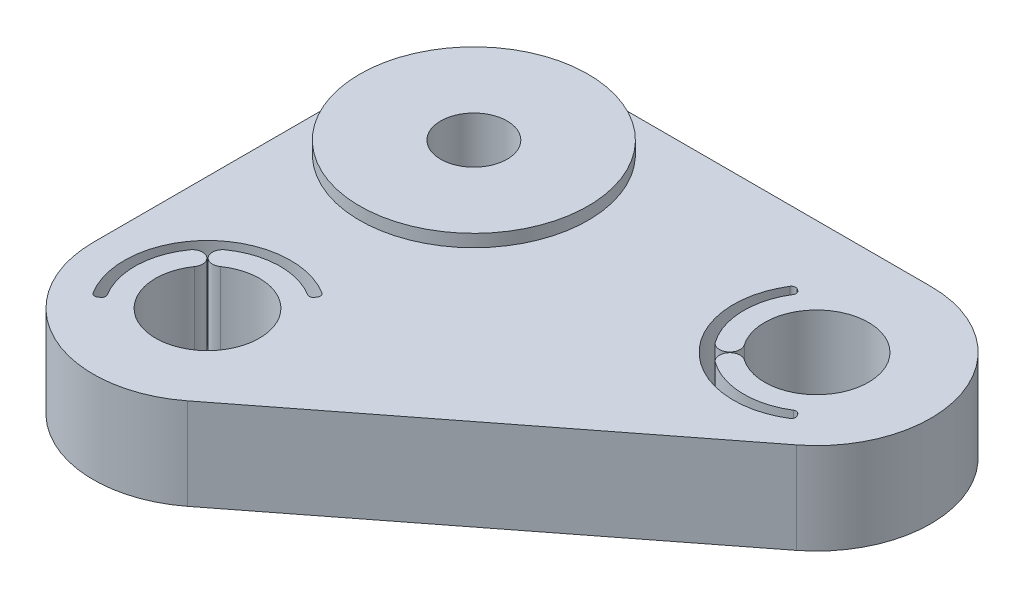
from build123d import *

# Parameters (mm, degrees)
SKETCH2_R            = 1.6
SKETCH2_R_2          = 2.5
BOSS_EXTRUDE1_DEPTH  = 1.57
SKETCH3_R            = 2.5
SKETCH3_R_2          = 1.6
BOSS_EXTRUDE2_DEPTH  = 2.83
SKETCH4_R            = 5.5
SKETCH4_R_2          = 1.6
BOSS_EXTRUDE3_DEPTH  = 0.6
BORE_RELIEF_DEPTH    = 30.065540164
SKETCH6_W            = 1.221153846
SKETCH6_H            = 0.325641026
PART_NUM_RIGHT_DEPTH = 0.4


with BuildPart() as part:
    # Sketch2 → Boss-Extrude1 (new body)
    with BuildSketch(Plane(origin=(0, 0, 0), x_dir=(1, 0, 0), z_dir=(0, 1, 0))):
        with BuildLine():
            Line((-5.5, 0), (-5.5, 12.825))
            ThreePointArc((-5.5, 12.825), (-3.889087297, 16.714087297), (0, 18.325))
            Line((0, 18.325), (16.5, 18.325))
            ThreePointArc((16.5, 18.325), (21.702583448, 14.609131572), (19.875306686, 8.48250017))
            Line((19.875306686, 8.48250017), (3.375306686, -4.34249983))
            ThreePointArc((3.375306686, -4.34249983), (-2.417210502, -4.940353569), (-5.5, 0))
        make_face()
        with Locations((0, 12.825)):
            Circle(SKETCH2_R, mode=Mode.SUBTRACT)
        with Locations((16.5, 12.825)):
            Circle(SKETCH2_R_2, mode=Mode.SUBTRACT)
        Circle(SKETCH2_R_2, mode=Mode.SUBTRACT)
    extrude(amount=BOSS_EXTRUDE1_DEPTH)

    # Sketch3 → Boss-Extrude2 (add)
    with BuildSketch(Plane(origin=(0, 1.57, 0), x_dir=(1, 0, 0), z_dir=(0, 1, 0))):
        with BuildLine():
            Line((3.375306686, -4.34249983), (19.875306686, 8.48250017))
            ThreePointArc((19.875306686, 8.48250017), (21.702583448, 14.609131572), (16.5, 18.325))
            Line((16.5, 18.325), (0, 18.325))
            ThreePointArc((0, 18.325), (-3.889087297, 16.714087297), (-5.5, 12.825))
            Line((-5.5, 12.825), (-5.5, 0))
            ThreePointArc((-5.5, 0), (-2.417210502, -4.940353569), (3.375306686, -4.34249983))
        make_face()
        Circle(SKETCH3_R, mode=Mode.SUBTRACT)
        with Locations((16.5, 12.825)):
            Circle(SKETCH3_R, mode=Mode.SUBTRACT)
        with Locations((0, 12.825)):
            Circle(SKETCH3_R_2, mode=Mode.SUBTRACT)
    extrude(amount=BOSS_EXTRUDE2_DEPTH)

    # Sketch4 → Boss-Extrude3 (add)
    with BuildSketch(Plane(origin=(0, 4.4, 0), x_dir=(1, 0, 0), z_dir=(0, 1, 0))):
        with Locations((0, 12.825)):
            Circle(SKETCH4_R)
        with Locations((0, 12.825)):
            Circle(SKETCH4_R_2, mode=Mode.SUBTRACT)
    extrude(amount=BOSS_EXTRUDE3_DEPTH)

    # Sketch5 → bore relief (cut, through all)
    with BuildSketch(Plane.XZ):
        with BuildLine():
            Line((13.473568524, -14.944130133), (13.391536548, -15.001569541))
            ThreePointArc((13.391536548, -15.001569541), (13.236918666, -15.033718169), (13.107180275, -14.943672771))
            ThreePointArc((13.107180275, -14.943672771), (13.671572875, -9.996572875), (18.618672771, -9.432180275))
            ThreePointArc((18.618672771, -9.432180275), (18.708718169, -9.561918666), (18.676569541, -9.716536548))
            Line((18.676569541, -9.716536548), (18.619130133, -9.798568524))
            ThreePointArc((18.619130133, -9.798568524), (18.495341896, -9.879803803), (18.349607847, -9.853644954))
            ThreePointArc((18.349607847, -9.853644954), (16.405370812, -9.326279474), (14.492482473, -9.957967845))
            ThreePointArc((14.492482473, -9.957967845), (14.369694669, -10.654332085), (15.066058909, -10.777119889))
            ThreePointArc((15.066058909, -10.777119889), (14.732233047, -11.057233047), (14.452119889, -11.391058909))
            ThreePointArc((14.452119889, -11.391058909), (14.329332085, -10.694694669), (13.632967845, -10.817482473))
            ThreePointArc((13.632967845, -10.817482473), (13.001279474, -12.730370812), (13.528644954, -14.674607847))
            ThreePointArc((13.528644954, -14.674607847), (13.554803803, -14.820341896), (13.473568524, -14.944130133))
        make_face()
        with BuildLine():
            Line((2.119130133, -3.026431476), (2.176569541, -3.108463452))
            ThreePointArc((2.176569541, -3.108463452), (2.208718169, -3.263081334), (2.118672771, -3.392819725))
            ThreePointArc((2.118672771, -3.392819725), (-2.828427125, -2.828427125), (-3.392819725, 2.118672771))
            ThreePointArc((-3.392819725, 2.118672771), (-3.263081334, 2.208718169), (-3.108463452, 2.176569541))
            Line((-3.108463452, 2.176569541), (-3.026431476, 2.119130133))
            ThreePointArc((-3.026431476, 2.119130133), (-2.945196197, 1.995341896), (-2.971355046, 1.849607847))
            ThreePointArc((-2.971355046, 1.849607847), (-3.498720526, -0.094629188), (-2.867032155, -2.007517527))
            ThreePointArc((-2.867032155, -2.007517527), (-2.170667915, -2.130305331), (-2.047880111, -1.433941091))
            ThreePointArc((-2.047880111, -1.433941091), (-1.767766953, -1.767766953), (-1.433941091, -2.047880111))
            ThreePointArc((-1.433941091, -2.047880111), (-2.130305331, -2.170667915), (-2.007517527, -2.867032155))
            ThreePointArc((-2.007517527, -2.867032155), (-0.094629188, -3.498720526), (1.849607847, -2.971355046))
            ThreePointArc((1.849607847, -2.971355046), (1.995341896, -2.945196197), (2.119130133, -3.026431476))
        make_face()
    extrude(amount=-BORE_RELIEF_DEPTH, mode=Mode.SUBTRACT)

    # Sketch6 → Part Num Right (cut)
    # profile 1 of 6: a face of its own
    with BuildSketch(Plane(origin=(0, 0, -18.325), x_dir=(-1, 0, 0), z_dir=(0, 0, -1))):
        with BuildLine():
            Line((-1.45224359, 0.625), (-2.0876252, 0.625))
            add(Edge.make_bspline(
                [(-2.0876252, 0.625), (-2.130026081, 0.625141139), (-2.211440469, 0.625412141), (-2.328074793, 0.626923226), (-2.43405366, 0.631254248), (-2.529321657, 0.63498132), (-2.613877037, 0.641777582), (-2.687979079, 0.648273311), (-2.75128649, 0.656776561), (-2.789609513, 0.664673623), (-2.806961138, 0.668249199)],
                knots=[0, 0, 0, 0, 1.410062039, 2.707475311, 3.878576406, 4.937260626, 5.877586885, 6.699081471, 7.410979367, 8, 8, 8, 8], degree=3))
            add(Edge.make_bspline(
                [(-2.806961138, 0.668249199), (-2.830190395, 0.673987843), (-2.876153367, 0.685342711), (-2.942323824, 0.709354569), (-3.00540418, 0.737096928), (-3.065163434, 0.769930236), (-3.121585925, 0.807300062), (-3.174665971, 0.849356633), (-3.22369187, 0.896460289), (-3.27040789, 0.946659811), (-3.311199899, 1.002140823), (-3.347923528, 1.060087813), (-3.378751756, 1.121616403), (-3.403010132, 1.186416258), (-3.423346638, 1.253851724), (-3.437014669, 1.324589154), (-3.445527358, 1.398398406), (-3.446368412, 1.448619001), (-3.446794872, 1.474083534)],
                knots=[0, 0, 0, 0, 1.027276577, 2.032638556, 3.019345632, 3.985365262, 4.957888996, 5.923693931, 6.890056973, 7.876427719, 8.865527834, 9.843495157, 10.821038291, 11.815616373, 12.812734995, 13.843357168, 14.906466538, 16, 16, 16, 16], degree=3))
            add(Edge.make_bspline(
                [(-3.446794872, 1.474083534), (-3.445462315, 1.516388284), (-3.442862152, 1.59893581), (-3.418618182, 1.718733216), (-3.378908392, 1.830486009), (-3.324180043, 1.934038669), (-3.25451789, 2.027427231), (-3.170799824, 2.109176017), (-3.073453386, 2.178216591), (-2.982404769, 2.22558451), (-2.901939035, 2.256063059), (-2.835500191, 2.277615533), (-2.762971613, 2.293986719), (-2.685393831, 2.30886584), (-2.602167628, 2.320219804), (-2.513460601, 2.328283277), (-2.419050889, 2.333468151), (-2.354335533, 2.334225683), (-2.32104367, 2.334615385)],
                knots=[0, 0, 0, 0, 1.260402266, 2.459371274, 3.627181936, 4.786749125, 5.93865593, 7.087644312, 8.261344208, 9.485713728, 10.136162886, 10.825977872, 11.566646758, 12.35154167, 13.181268117, 14.0701832, 15.007234106, 16, 16, 16, 16], degree=3))
            Line((-2.32104367, 2.334615385), (-3.4875, 3.8))
            Line((-3.4875, 3.8), (-3.135146234, 3.8))
            Line((-3.135146234, 3.8), (-1.968689904, 2.334615385))
            Line((-1.968689904, 2.334615385), (-1.737179487, 2.334615385))
            Line((-1.737179487, 2.334615385), (-1.737179487, 3.8))
            Line((-1.737179487, 3.8), (-1.45224359, 3.8))
            Line((-1.45224359, 3.8), (-1.45224359, 0.625))
        make_face()
        with BuildLine():
            Line((-1.737179487, 0.950641026), (-1.737179487, 2.008974359))
            Line((-1.737179487, 2.008974359), (-2.318499599, 2.013426482))
            add(Edge.make_bspline(
                [(-2.318499599, 2.013426482), (-2.345641352, 2.013438497), (-2.3982498, 2.013461784), (-2.474359643, 2.009838765), (-2.545225902, 2.005717644), (-2.610576629, 1.999412535), (-2.670443958, 1.991291581), (-2.724788345, 1.981117517), (-2.773729885, 1.96931444), (-2.830628281, 1.950859418), (-2.894895113, 1.922881499), (-2.963298511, 1.879499305), (-3.023115323, 1.827034935), (-3.072846399, 1.76628401), (-3.112790455, 1.699202433), (-3.14053516, 1.627308361), (-3.158818759, 1.551734554), (-3.160833885, 1.499844063), (-3.161858974, 1.473447516)],
                knots=[0, 0, 0, 0, 1.146399208, 2.222048177, 3.218135709, 4.144938032, 4.994811973, 5.769438708, 6.479732432, 7.119818093, 8.294689872, 9.430121864, 10.527913442, 11.641375077, 12.733452768, 13.811150417, 14.886538365, 16, 16, 16, 16], degree=3))
            add(Edge.make_bspline(
                [(-3.161858974, 1.473447516), (-3.160781981, 1.447909559), (-3.158647773, 1.397302648), (-3.140826274, 1.323382177), (-3.111726588, 1.253093511), (-3.071896587, 1.187403868), (-3.022323878, 1.128216571), (-2.964582838, 1.077729723), (-2.90003224, 1.035786689), (-2.840189636, 1.008112572), (-2.786310218, 0.991829079), (-2.739745176, 0.98000891), (-2.686671932, 0.971730598), (-2.627715149, 0.964116763), (-2.562615835, 0.957669012), (-2.491334318, 0.953389312), (-2.413921566, 0.950831329), (-2.360266864, 0.950705936), (-2.332491987, 0.950641026)],
                knots=[0, 0, 0, 0, 1.100596872, 2.180981401, 3.259506136, 4.371595435, 5.481727359, 6.576991111, 7.667816242, 8.793363246, 9.406619729, 10.09427138, 10.864108636, 11.721733836, 12.6590937, 13.685439239, 14.801845161, 16, 16, 16, 16], degree=3))
            Line((-2.332491987, 0.950641026), (-1.737179487, 0.950641026))
        make_face(mode=Mode.SUBTRACT)
    # profile 2 of 6: a face of its own
    with BuildSketch(Plane(origin=(0, 0, -18.325), x_dir=(-1, 0, 0), z_dir=(0, 0, -1))):
        Polygon((-3.914903846, 0.625), (-4.24372496, 0.625), (-5.075, 1.923747997), (-5.90627504, 0.625), (-6.235096154, 0.625), (-5.239728566, 2.180699119), (-6.275801282, 3.8), (-5.946980168, 3.8), (-5.075, 2.43765024), (-4.203019832, 3.8), (-3.874198718, 3.8), (-4.910907452, 2.180699119), align=None)
    # profile 3 of 6: a face of its own
    with BuildSketch(Plane(origin=(0, 0, -18.325), x_dir=(-1, 0, 0), z_dir=(0, 0, -1))):
        with BuildLine():
            Line((-6.825320513, 0.625), (-7.460702123, 0.625))
            add(Edge.make_bspline(
                [(-7.460702123, 0.625), (-7.503103004, 0.625141139), (-7.584517392, 0.625412141), (-7.701151716, 0.626923226), (-7.807130583, 0.631254248), (-7.90239858, 0.63498132), (-7.98695396, 0.641777582), (-8.061056002, 0.648273311), (-8.124363413, 0.656776561), (-8.162686436, 0.664673623), (-8.180038061, 0.668249199)],
                knots=[0, 0, 0, 0, 1.410062039, 2.707475311, 3.878576406, 4.937260626, 5.877586885, 6.699081471, 7.410979367, 8, 8, 8, 8], degree=3))
            add(Edge.make_bspline(
                [(-8.180038061, 0.668249199), (-8.203267318, 0.673987843), (-8.24923029, 0.685342711), (-8.315400747, 0.709354569), (-8.378481103, 0.737096928), (-8.438240357, 0.769930236), (-8.494662849, 0.807300062), (-8.547742894, 0.849356633), (-8.596768793, 0.896460289), (-8.643484813, 0.946659811), (-8.684276822, 1.002140823), (-8.721000451, 1.060087813), (-8.75182868, 1.121616403), (-8.776087055, 1.186416258), (-8.796423562, 1.253851724), (-8.810091593, 1.324589154), (-8.818604281, 1.398398406), (-8.819445335, 1.448619001), (-8.819871795, 1.474083534)],
                knots=[0, 0, 0, 0, 1.027276577, 2.032638556, 3.019345632, 3.985365262, 4.957888996, 5.923693931, 6.890056973, 7.876427719, 8.865527834, 9.843495157, 10.821038291, 11.815616373, 12.812734995, 13.843357168, 14.906466538, 16, 16, 16, 16], degree=3))
            add(Edge.make_bspline(
                [(-8.819871795, 1.474083534), (-8.818539238, 1.516388284), (-8.815939075, 1.59893581), (-8.791695105, 1.718733216), (-8.751985315, 1.830486009), (-8.697256966, 1.934038669), (-8.627594813, 2.027427231), (-8.543876747, 2.109176017), (-8.446530309, 2.178216591), (-8.355481692, 2.22558451), (-8.275015958, 2.256063059), (-8.208577114, 2.277615533), (-8.136048536, 2.293986719), (-8.058470754, 2.30886584), (-7.975244551, 2.320219804), (-7.886537524, 2.328283277), (-7.792127812, 2.333468151), (-7.727412456, 2.334225683), (-7.694120593, 2.334615385)],
                knots=[0, 0, 0, 0, 1.260402266, 2.459371274, 3.627181936, 4.786749125, 5.93865593, 7.087644312, 8.261344208, 9.485713728, 10.136162886, 10.825977872, 11.566646758, 12.35154167, 13.181268117, 14.0701832, 15.007234106, 16, 16, 16, 16], degree=3))
            Line((-7.694120593, 2.334615385), (-8.860576923, 3.8))
            Line((-8.860576923, 3.8), (-8.508223157, 3.8))
            Line((-8.508223157, 3.8), (-7.341766827, 2.334615385))
            Line((-7.341766827, 2.334615385), (-7.11025641, 2.334615385))
            Line((-7.11025641, 2.334615385), (-7.11025641, 3.8))
            Line((-7.11025641, 3.8), (-6.825320513, 3.8))
            Line((-6.825320513, 3.8), (-6.825320513, 0.625))
        make_face()
        with BuildLine():
            Line((-7.11025641, 0.950641026), (-7.11025641, 2.008974359))
            Line((-7.11025641, 2.008974359), (-7.691576522, 2.013426482))
            add(Edge.make_bspline(
                [(-7.691576522, 2.013426482), (-7.718718275, 2.013438497), (-7.771326723, 2.013461784), (-7.847436566, 2.009838765), (-7.918302825, 2.005717644), (-7.983653552, 1.999412535), (-8.043520881, 1.991291581), (-8.097865269, 1.981117517), (-8.146806808, 1.96931444), (-8.203705204, 1.950859418), (-8.267972036, 1.922881499), (-8.336375434, 1.879499305), (-8.396192246, 1.827034935), (-8.445923322, 1.76628401), (-8.485867378, 1.699202433), (-8.513612083, 1.627308361), (-8.531895682, 1.551734554), (-8.533910808, 1.499844063), (-8.534935897, 1.473447516)],
                knots=[0, 0, 0, 0, 1.146399208, 2.222048177, 3.218135709, 4.144938032, 4.994811973, 5.769438708, 6.479732432, 7.119818093, 8.294689872, 9.430121864, 10.527913442, 11.641375077, 12.733452768, 13.811150417, 14.886538365, 16, 16, 16, 16], degree=3))
            add(Edge.make_bspline(
                [(-8.534935897, 1.473447516), (-8.533858904, 1.447909559), (-8.531724696, 1.397302648), (-8.513903197, 1.323382177), (-8.484803511, 1.253093511), (-8.44497351, 1.187403868), (-8.395400801, 1.128216571), (-8.337659761, 1.077729723), (-8.273109163, 1.035786689), (-8.213266559, 1.008112572), (-8.159387141, 0.991829079), (-8.1128221, 0.98000891), (-8.059748855, 0.971730598), (-8.000792072, 0.964116763), (-7.935692758, 0.957669012), (-7.864411241, 0.953389312), (-7.786998489, 0.950831329), (-7.733343787, 0.950705936), (-7.70556891, 0.950641026)],
                knots=[0, 0, 0, 0, 1.100596872, 2.180981401, 3.259506136, 4.371595435, 5.481727359, 6.576991111, 7.667816242, 8.793363246, 9.406619729, 10.09427138, 10.864108636, 11.721733836, 12.6590937, 13.685439239, 14.801845161, 16, 16, 16, 16], degree=3))
            Line((-7.70556891, 0.950641026), (-7.11025641, 0.950641026))
        make_face(mode=Mode.SUBTRACT)
    # profile 4 of 6: a face of its own
    with BuildSketch(Plane(origin=(0, 0, -18.325), x_dir=(-1, 0, 0), z_dir=(0, 0, -1))):
        with Locations((-9.8375, 2.578846154)):
            Rectangle(SKETCH6_W, SKETCH6_H)
    # profile 5 of 6: a face of its own
    with BuildSketch(Plane(origin=(0, 0, -18.325), x_dir=(-1, 0, 0), z_dir=(0, 0, -1))):
        with BuildLine():
            add(Edge.make_bspline(
                [(-10.692307692, 2.213772035), (-10.692605252, 2.162883691), (-10.693183265, 2.064032348), (-10.699613476, 1.919991994), (-10.710295392, 1.784863731), (-10.724934298, 1.658641095), (-10.742748741, 1.541291485), (-10.766529966, 1.433128559), (-10.793574326, 1.333651525), (-10.824918703, 1.242536591), (-10.860284915, 1.158554174), (-10.898783373, 1.080158454), (-10.941915406, 1.007443081), (-10.987308913, 0.939336681), (-11.036552583, 0.876524658), (-11.089475169, 0.819289299), (-11.145610526, 0.766743659), (-11.205224271, 0.719751782), (-11.267748209, 0.678804629), (-11.331332802, 0.641686961), (-11.397791612, 0.612325862), (-11.465485397, 0.587218741), (-11.53495955, 0.567330508), (-11.606244336, 0.55349668), (-11.679403722, 0.544841944), (-11.72877997, 0.544011104), (-11.753821114, 0.543589744)],
                knots=[0, 0, 0, 0, 1.64625301, 3.197870201, 4.6634513, 6.030635694, 7.308242971, 8.501545196, 9.611429483, 10.641742253, 11.616230371, 12.55791849, 13.464870342, 14.34944951, 15.20427819, 16.044004467, 16.869007726, 17.689551165, 18.496129964, 19.285613293, 20.0683943, 20.843080271, 21.620342827, 22.403213977, 23.190190624, 24, 24, 24, 24], degree=3))
            add(Edge.make_bspline(
                [(-11.753821114, 0.543589744), (-11.779084115, 0.543940127), (-11.829348596, 0.544637268), (-11.903394266, 0.55444994), (-11.976150187, 0.56711544), (-12.046512508, 0.587428816), (-12.115811644, 0.611736404), (-12.182324266, 0.643809882), (-12.248398621, 0.678692279), (-12.311033039, 0.721245869), (-12.372098923, 0.768274589), (-12.429341813, 0.821664209), (-12.48422499, 0.879937166), (-12.53467554, 0.944393116), (-12.582855701, 1.01404376), (-12.626936507, 1.08947297), (-12.667834758, 1.170513584), (-12.706319232, 1.256789911), (-12.739972889, 1.350606524), (-12.76989368, 1.451378265), (-12.794418831, 1.56001767), (-12.814700699, 1.675919549), (-12.83044329, 1.799658079), (-12.841900481, 1.930982551), (-12.847954611, 2.069975122), (-12.849094522, 2.165005487), (-12.849679487, 2.213772035)],
                knots=[0, 0, 0, 0, 0.810910589, 1.61342667, 2.396193133, 3.181089899, 3.963115317, 4.752255436, 5.550715454, 6.36105385, 7.181178335, 8.024612154, 8.872680183, 9.750181803, 10.651284446, 11.591556747, 12.554036451, 13.566402641, 14.62422919, 15.753422176, 16.94128843, 18.199818041, 19.531985927, 20.947085226, 22.433341622, 24, 24, 24, 24], degree=3))
            add(Edge.make_bspline(
                [(-12.849679487, 2.213772035), (-12.849080924, 2.26232526), (-12.847912036, 2.357141006), (-12.842038265, 2.4955172), (-12.83013616, 2.626125067), (-12.815629647, 2.749153833), (-12.794714093, 2.86444268), (-12.771428832, 2.972610751), (-12.741727174, 3.072641678), (-12.708871775, 3.165654117), (-12.670922786, 3.251564969), (-12.630332548, 3.332271074), (-12.585593715, 3.407272206), (-12.538338043, 3.477364331), (-12.486932364, 3.541267492), (-12.432791919, 3.600192302), (-12.374993685, 3.653674679), (-12.31361345, 3.701258682), (-12.250387024, 3.744132824), (-12.184299788, 3.780259022), (-12.116898783, 3.811753694), (-12.047482952, 3.837071727), (-11.976494939, 3.857085732), (-11.903679104, 3.870710162), (-11.829338694, 3.88031367), (-11.779080803, 3.881043462), (-11.753821114, 3.881410256)],
                knots=[0, 0, 0, 0, 1.561431216, 3.049195289, 4.452146966, 5.778046447, 7.031138842, 8.218704273, 9.334037798, 10.384210803, 11.388620812, 12.352076869, 13.287433199, 14.19507451, 15.06813243, 15.922055533, 16.766344942, 17.596869952, 18.417486629, 19.220035357, 20.016159057, 20.807716045, 21.59340902, 22.384936649, 23.188266813, 24, 24, 24, 24], degree=3))
            add(Edge.make_bspline(
                [(-11.753821114, 3.881410256), (-11.728780843, 3.880985162), (-11.679406316, 3.880146959), (-11.606234323, 3.871546161), (-11.535052897, 3.857521158), (-11.465719736, 3.838475275), (-11.398092964, 3.814269078), (-11.33283499, 3.783479729), (-11.269084225, 3.747768738), (-11.207130629, 3.707141318), (-11.148158571, 3.660581379), (-11.091816508, 3.609094936), (-11.039579155, 3.551355125), (-10.990675088, 3.488283519), (-10.944904938, 3.420005674), (-10.901955557, 3.346733625), (-10.863574341, 3.267574197), (-10.827406241, 3.183135875), (-10.795523785, 3.091351453), (-10.767684614, 2.991533526), (-10.744213659, 2.883001243), (-10.725518715, 2.765749411), (-10.710203388, 2.639959542), (-10.699624006, 2.505431183), (-10.69318648, 2.362452483), (-10.692605967, 2.264236572), (-10.692307692, 2.213772035)],
                knots=[0, 0, 0, 0, 0.810976328, 1.599087026, 2.383086309, 3.159618043, 3.926613167, 4.707144544, 5.494386734, 6.292609454, 7.104690378, 7.92621526, 8.762510248, 9.62398222, 10.509836085, 11.424023232, 12.373226806, 13.358118208, 14.398657954, 15.5185989, 16.713620699, 17.994156382, 19.364120462, 20.818119981, 22.365111093, 24, 24, 24, 24], degree=3))
        make_face()
        with BuildLine():
            add(Edge.make_bspline(
                [(-10.97724359, 2.2125), (-10.977354321, 2.254907579), (-10.977569229, 2.337212362), (-10.983021074, 2.456603995), (-10.990609485, 2.568147672), (-11.000156147, 2.671799855), (-11.014453617, 2.767198295), (-11.030675009, 2.854739556), (-11.050131453, 2.934261741), (-11.073265846, 3.006459314), (-11.099616779, 3.072356193), (-11.128341633, 3.133703321), (-11.159456859, 3.191246897), (-11.193676331, 3.244779303), (-11.231490318, 3.294001546), (-11.272054797, 3.339147401), (-11.315605639, 3.380033045), (-11.375879917, 3.42855602), (-11.455066105, 3.479288538), (-11.555347495, 3.522923324), (-11.658436563, 3.550522248), (-11.728426987, 3.554022264), (-11.763361378, 3.555769231)],
                knots=[0, 0, 0, 0, 1.459193451, 2.832007961, 4.111736495, 5.306635028, 6.412683014, 7.430020708, 8.369596877, 9.227877302, 10.036669781, 10.810175692, 11.557788084, 12.286326232, 12.994037279, 13.69140682, 14.37267704, 15.047194847, 16.352618509, 17.594157723, 18.799169539, 20, 20, 20, 20], degree=3))
            add(Edge.make_bspline(
                [(-11.763361378, 3.555769231), (-11.798496368, 3.55423738), (-11.868641717, 3.551179113), (-11.971660616, 3.524487765), (-12.070844428, 3.481096109), (-12.149119242, 3.431522171), (-12.208504078, 3.384009028), (-12.251068033, 3.343546211), (-12.290130478, 3.298226589), (-12.327180348, 3.249332926), (-12.361161005, 3.195926979), (-12.392061158, 3.138266698), (-12.420258189, 3.076191642), (-12.436322825, 3.032857667), (-12.444536258, 3.010702123)],
                knots=[0, 0, 0, 0, 1.353621445, 2.702441307, 4.075953605, 5.516772412, 6.261413105, 7.007624062, 7.778524365, 8.566925914, 9.372323995, 10.217594641, 11.088702136, 12, 12, 12, 12], degree=3))
            add(Edge.make_bspline(
                [(-12.444536258, 3.010702123), (-12.454108219, 2.982372288), (-12.473543404, 2.924850574), (-12.498591228, 2.835620689), (-12.518317412, 2.742001039), (-12.536064179, 2.644551112), (-12.548177308, 2.54255224), (-12.55792711, 2.43632002), (-12.563669948, 2.325774356), (-12.564381829, 2.250667471), (-12.56474359, 2.2125)],
                knots=[0, 0, 0, 0, 0.884706709, 1.796334032, 2.740027952, 3.714592787, 4.726048262, 5.777819803, 6.87074269, 8, 8, 8, 8], degree=3))
            add(Edge.make_bspline(
                [(-12.56474359, 2.2125), (-12.564344607, 2.174333349), (-12.563564014, 2.099661985), (-12.558435447, 1.990417712), (-12.550194266, 1.886477881), (-12.539040009, 1.7877482), (-12.523727575, 1.694404394), (-12.505338856, 1.606312902), (-12.483780226, 1.52349743), (-12.45905172, 1.445744551), (-12.431183434, 1.373333218), (-12.400395964, 1.306107553), (-12.367546302, 1.243704976), (-12.331843318, 1.186326202), (-12.293792149, 1.133636423), (-12.252026511, 1.086848523), (-12.209199325, 1.043686402), (-12.148290004, 0.995298485), (-12.069197408, 0.94557191), (-11.970100616, 0.901055337), (-11.867539709, 0.874709227), (-11.79806245, 0.871055605), (-11.763361378, 0.869230769)],
                knots=[0, 0, 0, 0, 1.313528337, 2.569860077, 3.762944266, 4.901481389, 5.988248151, 7.017139294, 7.997571128, 8.932104357, 9.823695246, 10.66607014, 11.475539426, 12.248954257, 12.990316782, 13.708962568, 14.405488541, 15.08007697, 16.381737273, 17.610043218, 18.806313575, 20, 20, 20, 20], degree=3))
            add(Edge.make_bspline(
                [(-11.763361378, 0.869230769), (-11.72823853, 0.871057764), (-11.657928848, 0.874715083), (-11.554295037, 0.900962383), (-11.454605007, 0.945255295), (-11.375679085, 0.995359976), (-11.315627243, 1.043498484), (-11.27289328, 1.084583683), (-11.232563571, 1.12930733), (-11.194930734, 1.178306398), (-11.160920045, 1.231736727), (-11.129426643, 1.288863145), (-11.100930964, 1.350119145), (-11.074480566, 1.415979603), (-11.051591642, 1.48829581), (-11.031011831, 1.567802136), (-11.015127313, 1.655912716), (-11.001023257, 1.751759147), (-10.990362195, 1.855534565), (-10.983073961, 1.967342293), (-10.977552671, 2.087150117), (-10.97734868, 2.169879843), (-10.97724359, 2.2125)],
                knots=[0, 0, 0, 0, 1.207779899, 2.417760083, 3.652287919, 4.947299644, 5.621638849, 6.297435916, 6.984320042, 7.691843698, 8.42018894, 9.161205785, 9.934506883, 10.743085206, 11.601138371, 12.542248028, 13.566483018, 14.679455109, 15.87477181, 17.154161492, 18.533899613, 20, 20, 20, 20], degree=3))
        make_face(mode=Mode.SUBTRACT)
    # profile 6 of 6: a face of its own
    with BuildSketch(Plane(origin=(0, 0, -18.325), x_dir=(-1, 0, 0), z_dir=(0, 0, -1))):
        Polygon((-13.809430088, 0.625), (-14.396474359, 0.625), (-14.396474359, 3.8), (-14.111538462, 3.8), (-14.111538462, 0.950641026), (-13.623076923, 0.950641026), align=None)
    extrude(amount=-PART_NUM_RIGHT_DEPTH, mode=Mode.SUBTRACT)


solid = part.part
